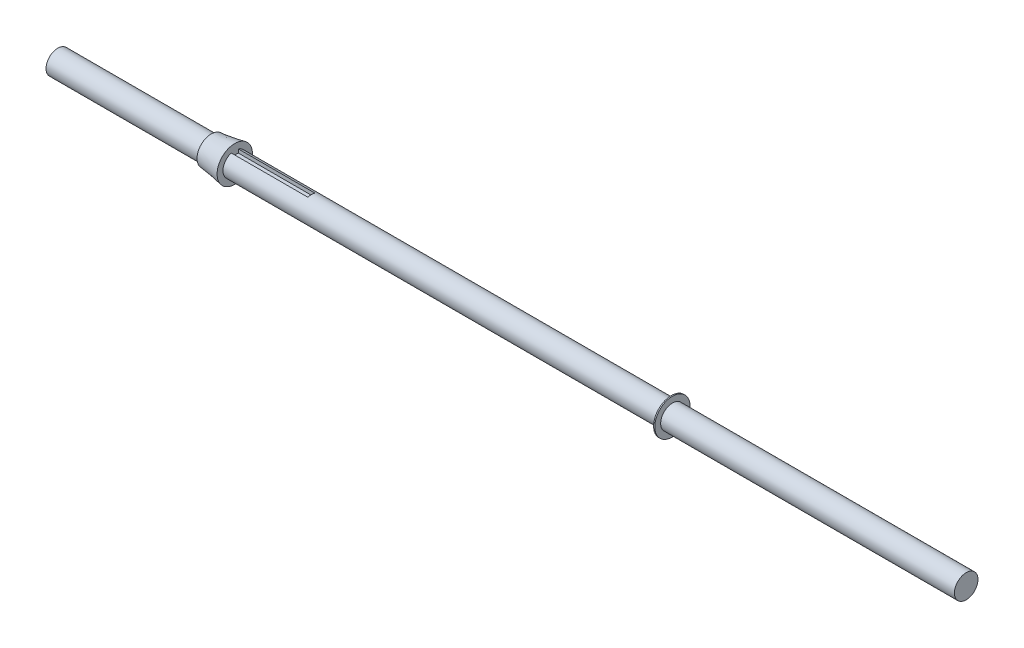
from build123d import *

# Parameters (mm, degrees)
SKETCH3_R           = 10
BOSS_EXTRUDE1_DEPTH = 750
SKETCH6_R           = 15
BOSS_EXTRUDE2_DEPTH = 1
BOSS_EXTRUDE3_START = 20
SKETCH7_R           = 10
BOSS_EXTRUDE3_DEPTH = 20
SKETCH8_W           = 65
SKETCH8_H           = 6
CUT_EXTRUDE1_DEPTH  = 6


with BuildPart() as part:
    # Sketch3 → Boss-Extrude1 (new body)
    with BuildSketch(Plane(origin=(0, 0, 0), x_dir=(0, 0, -1), z_dir=(1, 0, 0))):
        Circle(SKETCH3_R)
    extrude(amount=BOSS_EXTRUDE1_DEPTH)

    # Loft1: read off the stored shape, not the designer's step
    # Loft1: loft between two sections, ruled curve by curve
    loft1_from = [
        Edge.make_bspline([(130, 13.420275273, -6.700463537), (130, 0.019348199, -33.541014082), (130, -26.821202346, -20.140087008), (130, -13.420275273, 6.700463537), (130, -0.019348199, 33.541014082), (130, 26.821202346, 20.140087008), (130, 13.420275273, -6.700463537)], [0, 0, 0, 0, 0.5, 0.5, 0.5, 1, 1, 1, 1], 3, [1, 0.333333333, 0.333333333, 1, 0.333333333, 0.333333333, 1]),
    ]
    loft1_to = [
        Edge.make_bspline([(110, 7.764671539, -9.149310132), (110, -10.533948725, -24.67865321), (110, -26.063291803, -6.380032946), (110, -7.764671539, 9.149310132), (110, 10.533948725, 24.67865321), (110, 26.063291803, 6.380032946), (110, 7.764671539, -9.149310132)], [0, 0, 0, 0, 0.5, 0.5, 0.5, 1, 1, 1, 1], 3, [1, 0.333333333, 0.333333333, 1, 0.333333333, 0.333333333, 1]),
    ]
    loft1 = Solid(Shell([*[Face.make_surface_from_curves(loft1_from[k], loft1_to[k]) for k in range(1)], Face(Wire(loft1_from)), Face(Wire(loft1_to))]))
    add(loft1)

    # Sketch6 → Boss-Extrude2 (add)
    with BuildSketch(Plane(origin=(500, 0, 0), x_dir=(0, 0, -1), z_dir=(1, 0, 0))):
        Circle(SKETCH6_R)
    extrude(amount=BOSS_EXTRUDE2_DEPTH)

    # Sketch7 → Boss-Extrude3 (add)
    with BuildSketch(Plane.ZY.offset(BOSS_EXTRUDE3_START)):
        with Locations(Location((0, 0, 0), (0, 0, 180))):
            Circle(SKETCH7_R)
    extrude(amount=-BOSS_EXTRUDE3_DEPTH)

    # Sketch8 → Cut-Extrude1 (cut)
    with BuildSketch(Plane(origin=(0, 12.5, 0), x_dir=(1, 0, 0), z_dir=(0, 1, 0))):
        with Locations((162.5, 0)):
            Rectangle(SKETCH8_W, SKETCH8_H)
    extrude(amount=-CUT_EXTRUDE1_DEPTH, mode=Mode.SUBTRACT)


solid = part.part
